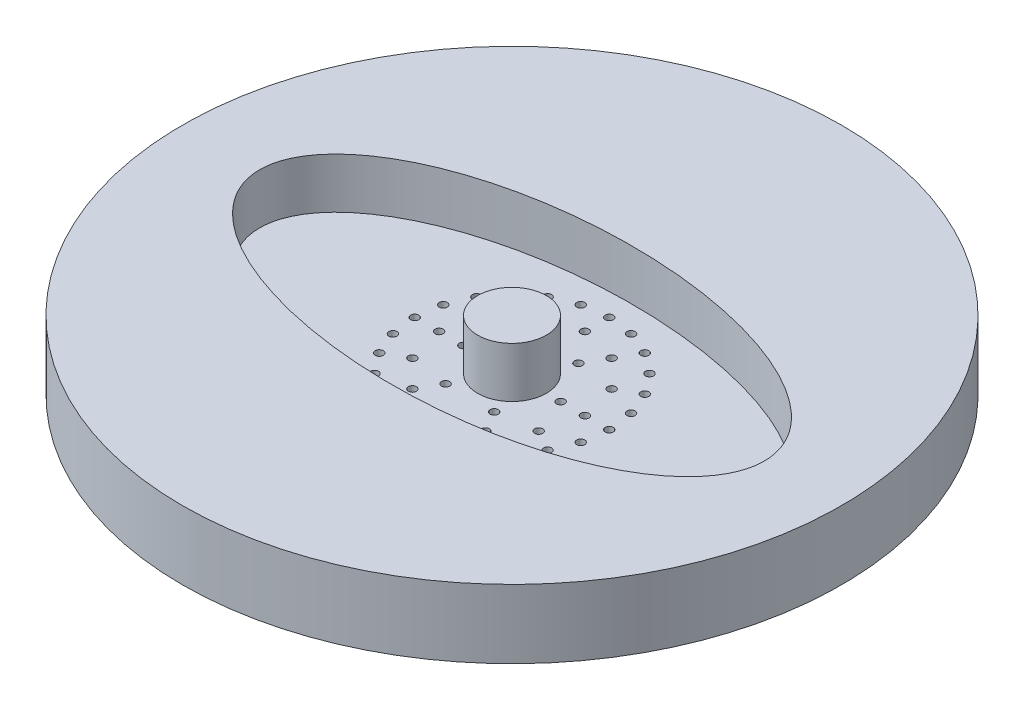
from build123d import *

# Parameters (mm, degrees)
SKETCH1_R                       = 60.96
BILLET_DEPTH                    = 12.7
SKETCH4_R                       = 0.7493
FIRST_KEROSENE_OUTLET_DEPTH     = 88.140881336
PRIMARY_HOLES_COUNT             = 6
SECOND_START                    = -12.7
SECOND_RING_OUTLINE_R           = 0.7493
SECOND_RING_DEPTH               = 12.7
THIRD_START                     = -12.7
THIRD_RING_OUTLINE_R            = 0.7493
THIRD_RING_DEPTH                = 12.7
SKETCH18_RX                     = 46.67504
SKETCH18_RY                     = 22.225
KEROSENE_WELL_DEPTH             = 9.3218
SKETCH17_R                      = 6.35
BOSS_EXTRUDE1_DEPTH             = 2.54
BOSS_EXTRUDE1_DIRECTION_2_REACH = 89.141
SKETCH21_R                      = 6.35
CUT_EXTRUDE1_DEPTH              = 2.54


# Read off the part's stored shape, not the designer's step: Second ring, Third Ring
with BuildPart() as part:
    # Sketch1 → Billet (new body)
    with BuildSketch(Plane(origin=(0, 0, 0), x_dir=(1, 0, 0), z_dir=(0, 1, 0))):
        with Locations(Location((0, 0, 0), (0, 0, 270))):
            Circle(SKETCH1_R)
    extrude(amount=-BILLET_DEPTH)

    # Sketch4 → First Kerosene Outlet (cut, symmetric)
    with BuildSketch(Plane(origin=(0, -12.7, 0), x_dir=(1, 0, 0), z_dir=(0, 1, 0))):
        with Locations(Location((8.9916, 0, 0), (0, 0, 270))):
            Circle(SKETCH4_R)
        with Locations(Location((13.4874, 0, 0), (0, 0, 270))):
            Circle(SKETCH4_R)
        with Locations(Location((17.9832, 0, 0), (0, 0, 270))):
            Circle(SKETCH4_R)
    first_kerosene_outlet = extrude(amount=FIRST_KEROSENE_OUTLET_DEPTH, both=True, mode=Mode.SUBTRACT)

    # Primary Holes: First Kerosene Outlet ×6 about axis
    primary_holes_axis = Axis((0, 0, 0), (0, 1, 0))
    for i in range(1, PRIMARY_HOLES_COUNT):
        add(first_kerosene_outlet.rotate(primary_holes_axis, i * 360 / PRIMARY_HOLES_COUNT), mode=Mode.SUBTRACT)

    # Second ring outline → Second ring (cut)
    with BuildSketch(Plane(origin=(0, 0, 0), x_dir=(1, 0, 0), z_dir=(0, 1, 0)).offset(SECOND_START)):
        with Locations((11.680431031, 6.7437)):
            Circle(SECOND_RING_OUTLINE_R)
        with Locations((0, 13.4874)):
            Circle(SECOND_RING_OUTLINE_R)
        with Locations((-11.680431031, 6.7437)):
            Circle(SECOND_RING_OUTLINE_R)
        with Locations((-11.680431031, -6.7437)):
            Circle(SECOND_RING_OUTLINE_R)
        with Locations((0, -13.4874)):
            Circle(SECOND_RING_OUTLINE_R)
        with Locations((11.680431031, -6.7437)):
            Circle(SECOND_RING_OUTLINE_R)
    extrude(amount=SECOND_RING_DEPTH, mode=Mode.SUBTRACT)

    # Third Ring outline → Third Ring (cut)
    with BuildSketch(Plane(origin=(0, 0, 0), x_dir=(1, 0, 0), z_dir=(0, 1, 0)).offset(THIRD_START)):
        with Locations((17.370437319, 4.654394652)):
            Circle(THIRD_RING_OUTLINE_R)
        with Locations((15.573908041, 8.9916)):
            Circle(THIRD_RING_OUTLINE_R)
        with Locations((12.716042667, 12.716042667)):
            Circle(THIRD_RING_OUTLINE_R)
        with Locations((4.654394652, 17.370437319)):
            Circle(THIRD_RING_OUTLINE_R)
        with Locations((0, 17.9832)):
            Circle(THIRD_RING_OUTLINE_R)
        with Locations((-4.654394652, 17.370437319)):
            Circle(THIRD_RING_OUTLINE_R)
        with Locations((-12.716042667, 12.716042667)):
            Circle(THIRD_RING_OUTLINE_R)
        with Locations((-15.573908041, 8.9916)):
            Circle(THIRD_RING_OUTLINE_R)
        with Locations((-17.370437319, 4.654394652)):
            Circle(THIRD_RING_OUTLINE_R)
        with Locations((-17.370437319, -4.654394652)):
            Circle(THIRD_RING_OUTLINE_R)
        with Locations((-15.573908041, -8.9916)):
            Circle(THIRD_RING_OUTLINE_R)
        with Locations((-12.716042667, -12.716042667)):
            Circle(THIRD_RING_OUTLINE_R)
        with Locations((-4.654394652, -17.370437319)):
            Circle(THIRD_RING_OUTLINE_R)
        with Locations((0, -17.9832)):
            Circle(THIRD_RING_OUTLINE_R)
        with Locations((4.654394652, -17.370437319)):
            Circle(THIRD_RING_OUTLINE_R)
        with Locations((12.716042667, -12.716042667)):
            Circle(THIRD_RING_OUTLINE_R)
        with Locations((15.573908041, -8.9916)):
            Circle(THIRD_RING_OUTLINE_R)
        with Locations((17.370437319, -4.654394652)):
            Circle(THIRD_RING_OUTLINE_R)
    extrude(amount=THIRD_RING_DEPTH, mode=Mode.SUBTRACT)

    # Sketch18 → Kerosene Well (cut)
    with BuildSketch(Plane(origin=(0, 0, 0), x_dir=(1, 0, 0), z_dir=(0, 1, 0))):
        with Locations(Location((0, 0), (0, 0, -180))):
            Ellipse(SKETCH18_RX, SKETCH18_RY)
    extrude(amount=-KEROSENE_WELL_DEPTH, mode=Mode.SUBTRACT)

    # Sketch17 → Boss-Extrude1 (add)
    with BuildSketch(Plane(origin=(0, 0, 0), x_dir=(1, 0, 0), z_dir=(0, 1, 0))):
        with Locations(Location((0, 0, 0), (0, 0, 270))):
            Circle(SKETCH17_R)
    extrude(amount=BOSS_EXTRUDE1_DEPTH)

    # Sketch17 → Boss-Extrude1 direction 2 (add, up to next)
    with BuildSketch(Plane(origin=(0, 0, 0), x_dir=(1, 0, 0), z_dir=(0, 1, 0)), mode=Mode.PRIVATE) as boss_extrude1_direction_2_sk1:
        with Locations(Location((0, 0, 0), (0, 0, 270))):
            Circle(SKETCH17_R)
    boss_extrude1_direction_2_tool1 = extrude(boss_extrude1_direction_2_sk1.sketch, amount=-BOSS_EXTRUDE1_DIRECTION_2_REACH, mode=Mode.PRIVATE) - part.part
    add(boss_extrude1_direction_2_tool1.solids().sort_by_distance((0, 0, 0))[0])

    # Sketch21 → Cut-Extrude1 (cut)
    with BuildSketch(Plane(origin=(0, 2.54, 0), x_dir=(1, 0, 0), z_dir=(0, 1, 0))):
        with Locations(Location((0, 0, 0), (0, 0, 270))):
            Circle(SKETCH21_R)
    extrude(amount=-CUT_EXTRUDE1_DEPTH, mode=Mode.SUBTRACT)


solid = part.part
